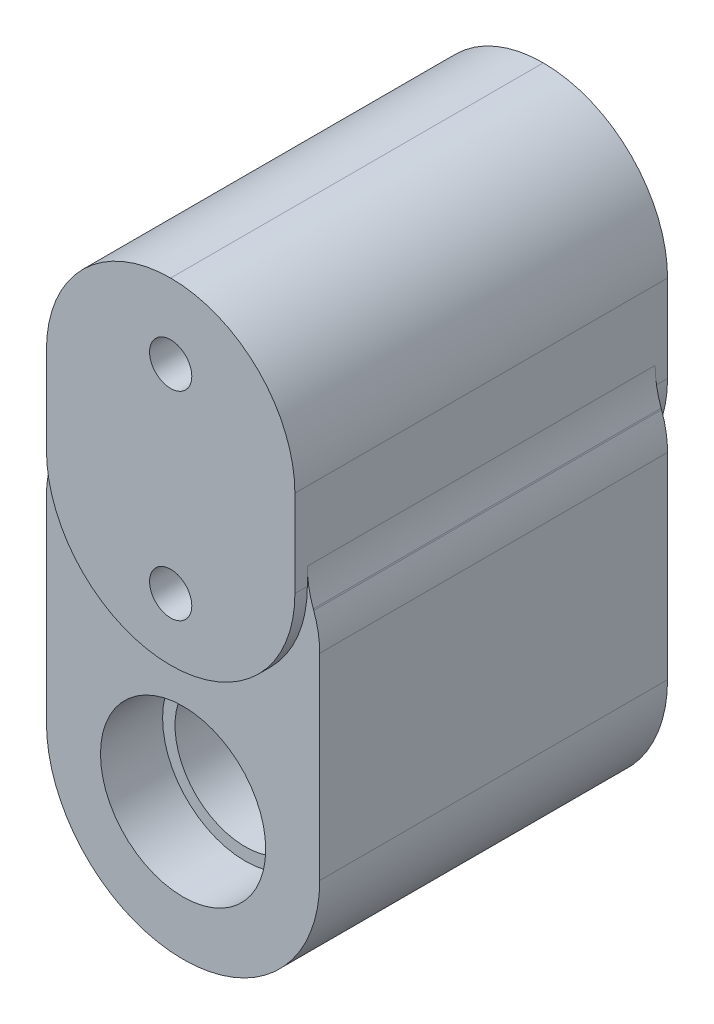
from build123d import *

# Parameters (mm, degrees)
EXTRUDE_537_DEPTH      = 14
EXTRUDE_537_DEPTH_BACK = 14
SKETCH_1_W             = 22
SKETCH_1_H             = 48
SKETCH_2_R             = 6.65
CUT_EXTRUDE_717_DEPTH  = 5
SKETCH_4_R             = 5.65
CUT_EXTRUDE_848_DEPTH  = 45.933283877
FILLET_1_R             = 11
SKETCH_5_R             = 1.7
CUT_EXTRUDE_1388_DEPTH = 48.68647607
SKETCH_9_R             = 1.7
EXTRUDE_1991_DEPTH     = 1
CUT_EXTRUDE_2402_REACH = 50.28
FILLET_2_R             = 8
FILLET_3_R             = 10


with BuildPart() as part:
    # Эскиз1 → Extrude 537 (new, two sides: drawn at the far end of the back side and taken through both)
    with BuildSketch(Plane.XY.offset(-EXTRUDE_537_DEPTH_BACK)):
        with Locations((0, 13)):
            Rectangle(SKETCH_1_W, SKETCH_1_H)
    extrude(amount=EXTRUDE_537_DEPTH + EXTRUDE_537_DEPTH_BACK)

    # Эскиз2 → Cut-Extrude 717 (cut)
    with BuildSketch(Plane.XY.offset(14)):
        Circle(SKETCH_2_R)
    cut_extrude_717 = extrude(amount=-CUT_EXTRUDE_717_DEPTH, mode=Mode.SUBTRACT)

    # Эскиз4 → Cut-Extrude 848 (cut, through all)
    with BuildSketch(Plane.XY.offset(9)):
        Circle(SKETCH_4_R)
    extrude(amount=-CUT_EXTRUDE_848_DEPTH, mode=Mode.SUBTRACT)

    # Зеркальное отражение2: Cut-Extrude 717 across plane
    add(cut_extrude_717.mirror(Plane.XY), mode=Mode.SUBTRACT)

    # Скругление1
    fillet_1_edges = [part.edges().sort_by_distance(p)[0] for p in [
        (11, -11, 0),
        (-11, -11, 0),
    ]]
    fillet(fillet_1_edges, radius=FILLET_1_R - 0.0001)  # a hair under: the kernel refuses the full size

    # Эскиз5 → Cut-Extrude 1388 (cut, through all)
    with BuildSketch(Plane(origin=(0, 0, -14), x_dir=(-1, 0, 0), z_dir=(0, 0, -1))):
        with Locations((0, 31)):
            Circle(SKETCH_5_R)
        with Locations((0, 15)):
            Circle(SKETCH_5_R)
    extrude(amount=-CUT_EXTRUDE_1388_DEPTH, mode=Mode.SUBTRACT)

    # Эскиз9 → Extrude 1991 (add)
    with BuildSketch(Plane.XY.offset(14)):
        with BuildLine():
            Line((-10, 37), (10, 37))
            Line((10, 37), (10, 20))
            ThreePointArc((10, 20), (0, 10), (-10, 20))
            Line((-10, 20), (-10, 37))
        make_face()
        with Locations(Location((0, 15, 0), (0, 0, 180))):
            Circle(SKETCH_9_R, mode=Mode.SUBTRACT)
        with Locations(Location((0, 31, 0), (0, 0, 180))):
            Circle(SKETCH_9_R, mode=Mode.SUBTRACT)
    extrude_1991 = extrude(amount=EXTRUDE_1991_DEPTH)

    # Зеркальное отражение1: Extrude 1991 across plane
    add(extrude_1991.mirror(Plane.XY))

    # Эскиз10 → Cut-Extrude 2402 (cut, up to next)
    with BuildSketch(Plane.XY.offset(14), mode=Mode.PRIVATE) as cut_extrude_2402_sk1:
        Polygon((-10, 37), (-11, 37), (-11, 17.252522581), (-10, 20), align=None)
    cut_extrude_2402_tool1 = extrude(cut_extrude_2402_sk1.sketch, amount=-CUT_EXTRUDE_2402_REACH, mode=Mode.PRIVATE) & part.part
    # Эскиз10 → Cut-Extrude 2402 (cut, up to next)
    with BuildSketch(Plane.XY.offset(14), mode=Mode.PRIVATE) as cut_extrude_2402_sk2:
        Polygon((11, 17.252522581), (10, 20), (10, 37), (11, 37), align=None)
    cut_extrude_2402_tool2 = extrude(cut_extrude_2402_sk2.sketch, amount=-CUT_EXTRUDE_2402_REACH, mode=Mode.PRIVATE) & part.part
    add(cut_extrude_2402_tool1.solids().sort_by_distance((-10.512461, 27.796012, 14))[0], mode=Mode.SUBTRACT)
    add(cut_extrude_2402_tool2.solids().sort_by_distance((10.512461, 27.796012, 14))[0], mode=Mode.SUBTRACT)

    # Скругление2
    fillet_2_edges = [part.edges().sort_by_distance(p)[0] for p in [
        (11, 17.252522581, 0),
        (10, 20, 0),
        (-10, 20, 0),
        (-11, 17.252522581, 0),
    ]]
    fillet(fillet_2_edges, radius=FILLET_2_R)

    # Скругление3
    fillet_3_edges = [part.edges().sort_by_distance(p)[0] for p in [
        (-10, 37, 0),
        (10, 37, 0),
    ]]
    fillet(fillet_3_edges, radius=FILLET_3_R - 0.0001)  # a hair under: the kernel refuses the full size


solid = part.part
